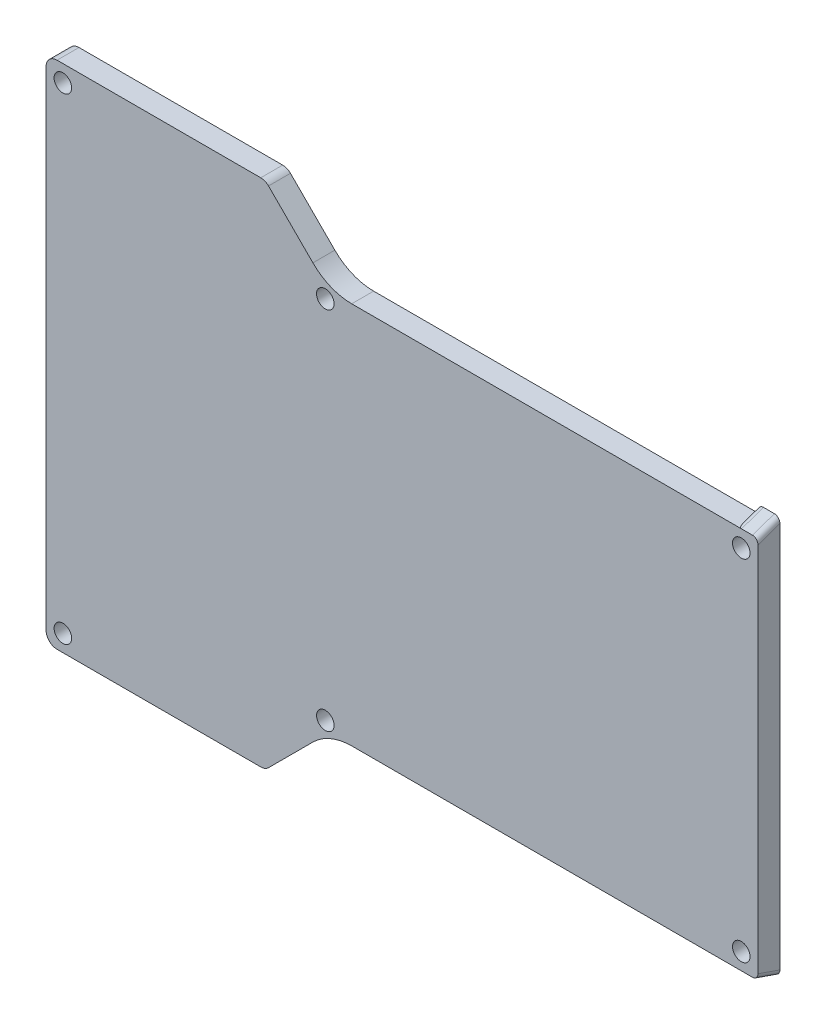
from build123d import *

# Parameters (mm, degrees)
SKETCH1_R           = 1.6
BOSS_EXTRUDE1_DEPTH = 4
CUT_EXTRUDE2_DEPTH  = 4
FILLET1_R           = 1
FILLET2_R           = 1


with BuildPart() as part:
    # Sketch1 → Boss-Extrude1 (new body)
    with BuildSketch(Plane.XY):
        with BuildLine():
            Line((-16.3, -104.269599188), (20.828427125, -104.269599188))
            ThreePointArc((20.828427125, -104.269599188), (21.593793989, -104.117358253), (22.242640687, -103.68381275))
            Line((22.242640687, -103.68381275), (30.337922061, -95.588531376))
            ThreePointArc((30.337922061, -95.588531376), (33.58215555, -93.420803863), (37.408989873, -92.659599188))
            Line((37.408989873, -92.659599188), (107.455, -92.659599188))
            Line((107.455, -92.659599188), (107.455, -94.05503188))
            Line((107.455, -94.05503188), (111.455, -94.05503188))
            Line((111.455, -94.05503188), (111.455, -21.479767457))
            Line((111.455, -21.479767457), (107.455, -21.479767457))
            Line((107.455, -21.479767457), (107.455, -22.874599188))
            Line((107.455, -22.874599188), (37.403989873, -22.874599188))
            ThreePointArc((37.403989873, -22.874599188), (33.57715555, -22.113394513), (30.332922061, -19.945667))
            Line((30.332922061, -19.945667), (22.242640687, -11.855385626))
            ThreePointArc((22.242640687, -11.855385626), (21.593793989, -11.421840123), (20.828427125, -11.269599188))
            Line((20.828427125, -11.269599188), (-16.3, -11.269599188))
            ThreePointArc((-16.3, -11.269599188), (-17.714213562, -11.855385626), (-18.3, -13.269599188))
            Line((-18.3, -13.269599188), (-18.3, -102.269599188))
            ThreePointArc((-18.3, -102.269599188), (-17.714213562, -103.68381275), (-16.3, -104.269599188))
        make_face()
        with Locations((32.596077775, -91.040201526)):
            Circle(SKETCH1_R, mode=Mode.SUBTRACT)
        with Locations((108.412106781, -89.616705969)):
            Circle(SKETCH1_R, mode=Mode.SUBTRACT)
        with Locations((108.412106781, -25.917492407)):
            Circle(SKETCH1_R, mode=Mode.SUBTRACT)
        with Locations((32.591077775, -24.493996851)):
            Circle(SKETCH1_R, mode=Mode.SUBTRACT)
        with Locations((-15.239339828, -14.33025936)):
            Circle(SKETCH1_R, mode=Mode.SUBTRACT)
        with Locations((-15.239339828, -101.208939016)):
            Circle(SKETCH1_R, mode=Mode.SUBTRACT)
    extrude(amount=BOSS_EXTRUDE1_DEPTH)

    # Sketch2 → Cut-Extrude2 (cut)
    with BuildSketch(Plane(origin=(111.455, 0, 0), x_dir=(0, 0, -1), z_dir=(1, 0, 0))):
        Polygon((0.5, -96.677507368), (0.5, -94.229460967), (-5.154376026, -92.256885677), (-5.154376026, -96.677507368), align=None)
        Polygon((-5.503644427, -23.398931928), (0.5, -21.305413491), (0.5, -17.849019739), (-5.503644427, -17.849019739), align=None)
    extrude(amount=-CUT_EXTRUDE2_DEPTH, mode=Mode.SUBTRACT)

    # Fillet1
    fillet1_edges = [part.edges().sort_by_distance(p)[0] for p in [
        (107.455, -93.357315534, 2),
        (111.455, -93.357315534, 2),
    ]]
    fillet(fillet1_edges, radius=FILLET1_R)

    # Fillet2
    fillet2_edges = [part.edges().sort_by_distance(p)[0] for p in [
        (111.455, -22.177183323, 2),
        (107.455, -22.177183323, 2),
    ]]
    fillet(fillet2_edges, radius=FILLET2_R)


solid = part.part
